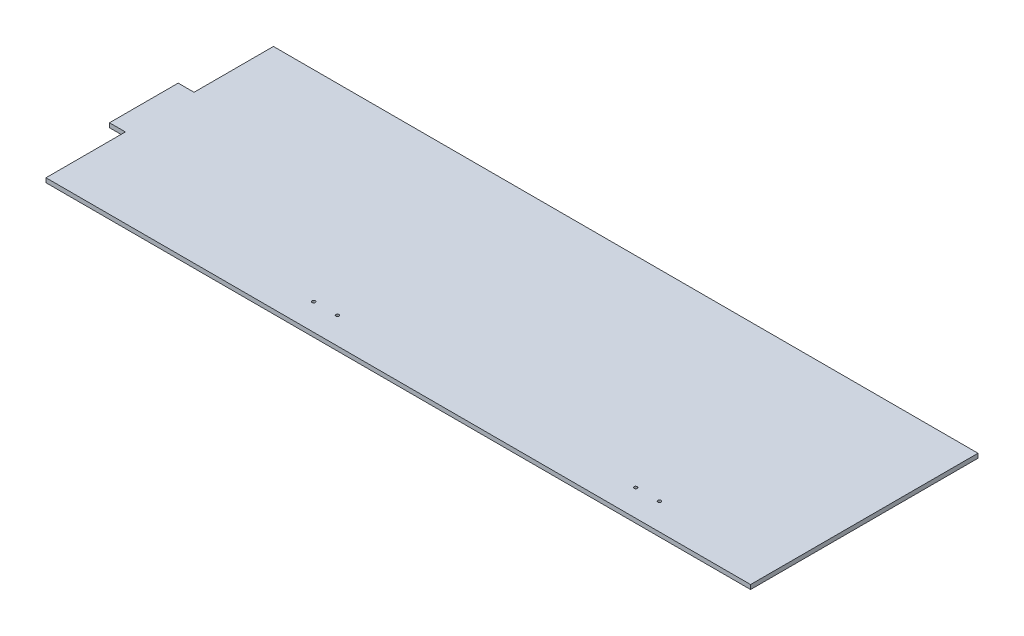
from build123d import *

# Parameters (mm, degrees)
BOSS_EXTRUDE1_START = 2
SKETCH1_R           = 1
BOSS_EXTRUDE1_DEPTH = 2.7432


with BuildPart() as part:
    # Sketch1 → Boss-Extrude1 (new body)
    with BuildSketch(Plane(origin=(0, 0, 0), x_dir=(1, 0, 0), z_dir=(0, 1, 0)).offset(BOSS_EXTRUDE1_START)):
        Polygon((-270, 21.625660705), (-280, 21.625660705), (-280, -21.625660705), (-270, -21.625660705), (-270, -71.625660705), (173.8, -71.625660705), (173.8, 71.625660705), (-270, 71.625660705), align=None)
        with Locations((-118.128664274, -54.904008218)):
            Circle(SKETCH1_R, mode=Mode.SUBTRACT)
        with Locations((-103.128664274, -54.904008218)):
            Circle(SKETCH1_R, mode=Mode.SUBTRACT)
        with Locations((84.671335726, -54.904008218)):
            Circle(SKETCH1_R, mode=Mode.SUBTRACT)
        with Locations((99.671335726, -54.904008218)):
            Circle(SKETCH1_R, mode=Mode.SUBTRACT)
    extrude(amount=BOSS_EXTRUDE1_DEPTH)


solid = part.part
